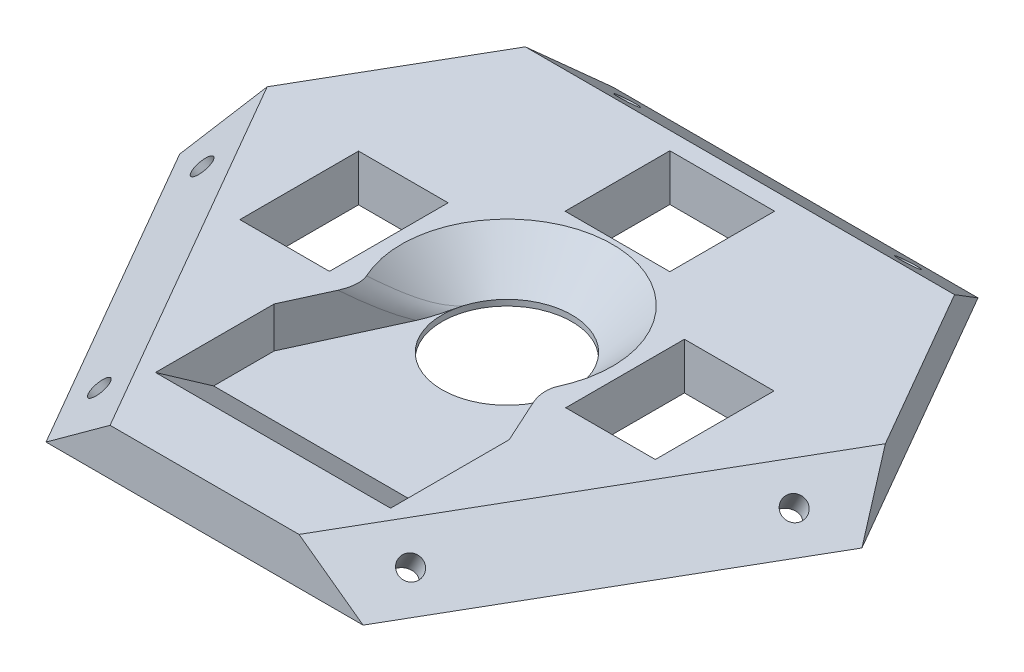
from build123d import *

# Parameters (mm, degrees)
BOSS_EXTRUDE1_DEPTH = 8
CHAMFER1_SIZE       = 10
CHAMFER1_SIZE_2     = 11.917535926
SKETCH4_R           = 1.85
CUT_EXTRUDE1_DEPTH  = 101.029376687
SKETCH5_R           = 11.15
CUT_EXTRUDE3_DEPTH  = 79.744901298
SKETCH6_R           = 1.85
CUT_EXTRUDE4_DEPTH  = 101.029376687
SKETCH7_R           = 1.85
CUT_EXTRUDE5_DEPTH  = 97.338690096
SKETCH8_W           = 15.4
SKETCH8_H           = 20.4
CUT_EXTRUDE6_DEPTH  = 79.744901298
SKETCH9_W           = 40.4
SKETCH9_H           = 10.4
CUT_EXTRUDE7_DEPTH  = 7
CUT_EXTRUDE8_DEPTH  = 7
CHAMFER2_SIZE       = 7
CHAMFER3_SIZE       = 10
CHAMFER3_SIZE_2     = 7.002075382
FILLET1_R           = 3
SKETCH11_W          = 18
SKETCH11_H          = 18
CUT_EXTRUDE9_DEPTH  = 79.744901364


with BuildPart() as part:
    # Sketch1 → Boss-Extrude1 (new body)
    with BuildSketch(Plane(origin=(0, 0, 0), x_dir=(1, 0, 0), z_dir=(0, 1, 0))):
        Polygon((-60, 0), (-30, -51.961524227), (30, -51.961524227), (60, 0), (30, 51.961524227), (-30, 51.961524227), align=None)
    extrude(amount=BOSS_EXTRUDE1_DEPTH)

    # Chamfer1
    # the kernel refuses this chamfer: 11.917535926, 10 mm, written as the material it takes off along each edge
    with BuildSketch(Plane(origin=(60.716329832, 8, -51.961524227), x_dir=(0, -0.9993728857116146, -0.0354095369136628), z_dir=(-1, 0, 0)), Plane(origin=(-75.358164916, 8, -26.601121946), x_dir=(-0.030665558503474466, -0.9993728857116146, 0.017704768456831187), z_dir=(0.4999999999999998, 0, 0.8660254037844388)), Plane(origin=(14.641835084, 8, 78.562646173), x_dir=(0.03066555850347504, -0.9993728857116146, 0.017704768456831523), z_dir=(0.4999999999999999, 0, -0.8660254037844388))) as chamfer1_piece_1:
        Polygon((CHAMFER1_SIZE * 0.999372885712, CHAMFER1_SIZE * 0.0354095369137), (-CHAMFER1_SIZE_2 * 0.0354095369135, CHAMFER1_SIZE_2 * 0.999372885707), (0, 0), align=None)
    extrude(amount=121.432659665, mode=Mode.SUBTRACT)

    # Sketch4 → Cut-Extrude1 (cut, through all)
    with BuildSketch(Plane(origin=(17.740047471, 24.412407781, 10.242221183), x_dir=(0.8301060005968394, -0.4979011414928883, -0.251034820439713), z_dir=(0.5566703992264198, 0.7660444431189777, 0.3213938048432698))):
        with Locations(Location((39.858257334, -1.394557769, 0), (0, 0, 164.627134315))):
            Circle(SKETCH4_R)
        with Locations(Location((9.338033447, -38.774045448, 0), (0, 0, 164.627134315))):
            Circle(SKETCH4_R)
    extrude(amount=-CUT_EXTRUDE1_DEPTH, mode=Mode.SUBTRACT)

    # Sketch5 → Cut-Extrude3 (cut, through all)
    with BuildSketch(Plane(origin=(0, 0, 0), x_dir=(1, 0, 0), z_dir=(0, 1, 0))):
        with Locations(Location((0, 0, 0), (0, 0, 270))):
            Circle(SKETCH5_R)
    extrude(amount=CUT_EXTRUDE3_DEPTH, mode=Mode.SUBTRACT)

    # Sketch6 → Cut-Extrude4 (cut, through all)
    with BuildSketch(Plane(origin=(-17.740047471, 24.412407781, 10.242221183), x_dir=(0.8307334510088673, 0.5133226132381532, 0.21536440772154375), z_dir=(-0.5566703992264165, 0.7660444431189809, 0.3213938048432678))):
        with Locations(Location((-39.882343662, 0.155348314, 0), (0, 0, 193.145847187))):
            Circle(SKETCH6_R)
        with Locations(Location((-10.837701827, -38.381892712, 0), (0, 0, 193.145847187))):
            Circle(SKETCH6_R)
    extrude(amount=-CUT_EXTRUDE4_DEPTH, mode=Mode.SUBTRACT)

    # Sketch7 → Cut-Extrude5 (cut, through all)
    with BuildSketch(Plane(origin=(0, 24.412407781, -20.484442365), x_dir=(1, 0, 0), z_dir=(0, 0.7660444431189811, -0.6427876096865357))):
        with Locations(Location((-24.128355545, 31.756069148, 0), (0, 0, 270))):
            Circle(SKETCH7_R)
        with Locations(Location((24.128355545, 31.756069148, 0), (0, 0, 270))):
            Circle(SKETCH7_R)
    extrude(amount=-CUT_EXTRUDE5_DEPTH, mode=Mode.SUBTRACT)

    # Sketch8 → Cut-Extrude6 (cut, through all)
    with BuildSketch(Plane(origin=(0, 8, 0), x_dir=(1, 0, 0), z_dir=(0, 1, 0))):
        with Locations((-28, 0)):
            Rectangle(SKETCH8_W, SKETCH8_H)
        with Locations((28, 0)):
            Rectangle(SKETCH8_W, SKETCH8_H)
    extrude(amount=-CUT_EXTRUDE6_DEPTH, mode=Mode.SUBTRACT)

    # Sketch9 → Cut-Extrude7 (cut)
    with BuildSketch(Plane(origin=(0, 8, 0), x_dir=(1, 0, 0), z_dir=(0, 1, 0))):
        with Locations((0, -25)):
            Rectangle(SKETCH9_W, SKETCH9_H)
    extrude(amount=-CUT_EXTRUDE7_DEPTH, mode=Mode.SUBTRACT)

    # Sketch10 → Cut-Extrude8 (cut)
    with BuildSketch(Plane(origin=(0, 8, 0), x_dir=(1, 0, 0), z_dir=(0, 1, 0))):
        Polygon((-20.2, -19.8), (-11.15, 0), (11.15, 0), (20.2, -19.8), align=None)
    extrude(amount=-CUT_EXTRUDE8_DEPTH, mode=Mode.SUBTRACT)

    # Chamfer2
    chamfer2_edges = [part.edges().sort_by_distance(p)[0] for p in [
        (0, 8, -11.15),
    ]]
    chamfer(chamfer2_edges, length=CHAMFER2_SIZE)

    # Chamfer3
    # the kernel refuses this chamfer: 10, 7.002075382 mm, written as the material it takes off along each edge
    with BuildSketch(Plane(origin=(20.2, 8, 30.2), x_dir=(0, 0.02220967419845712, 0.9997533347641299), z_dir=(-1, 0, 0))) as chamfer3_piece_1_section:
        Polygon((CHAMFER3_SIZE * 0.999753334764, -CHAMFER3_SIZE * 0.0222096741985), (-CHAMFER3_SIZE_2 * 0.0222096741988, -CHAMFER3_SIZE_2 * 0.999753334778), (0, 0), align=None)
    chamfer3_piece_1 = extrude(amount=40.4, mode=Mode.PRIVATE)
    chamfer3_piece_1 = split(chamfer3_piece_1, bisect_by=Plane(origin=(0, 1, 33.539189969), z_dir=(0, 1, 0)), keep=Keep.TOP, mode=Mode.PRIVATE)
    add(chamfer3_piece_1, mode=Mode.SUBTRACT)

    # Fillet1
    fillet1_edges = [part.edges().sort_by_distance(p)[0] for p in [
        (-13.4116744, 4.145370972, 4.948193714),
        (13.4116744, 4.145370972, 4.948193714),
    ]]
    fillet(fillet1_edges, radius=FILLET1_R)

    # Sketch11 → Cut-Extrude9 (cut, through all)
    with BuildSketch(Plane(origin=(0, 8, 0), x_dir=(1, 0, 0), z_dir=(0, 1, 0))):
        with Locations((0, 28)):
            Rectangle(SKETCH11_W, SKETCH11_H)
    extrude(amount=-CUT_EXTRUDE9_DEPTH, mode=Mode.SUBTRACT)


solid = part.part
